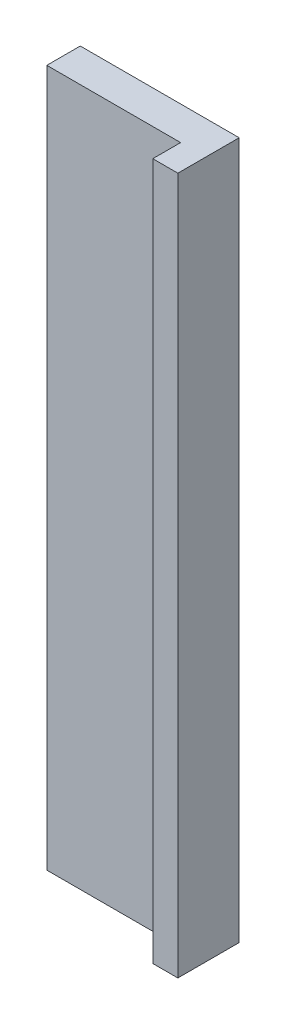
from build123d import *

# Parameters (mm, degrees)
CROQUIS1_W              = 28.5
CROQUIS1_H              = 125
SALIENTE_EXTRUIR1_DEPTH = 6
CROQUIS2_W              = 4.5
CROQUIS2_H              = 125
SALIENTE_EXTRUIR2_DEPTH = 5


with BuildPart() as part:
    # Croquis1 → Saliente-Extruir1 (new body)
    with BuildSketch(Plane.XY):
        with Locations((14.25, 62.5)):
            Rectangle(CROQUIS1_W, CROQUIS1_H)
    extrude(amount=SALIENTE_EXTRUIR1_DEPTH)

    # Croquis2 → Saliente-Extruir2 (add)
    with BuildSketch(Plane.XY.offset(6)):
        with Locations((26.25, 62.5)):
            Rectangle(CROQUIS2_W, CROQUIS2_H)
    extrude(amount=SALIENTE_EXTRUIR2_DEPTH)


solid = part.part
